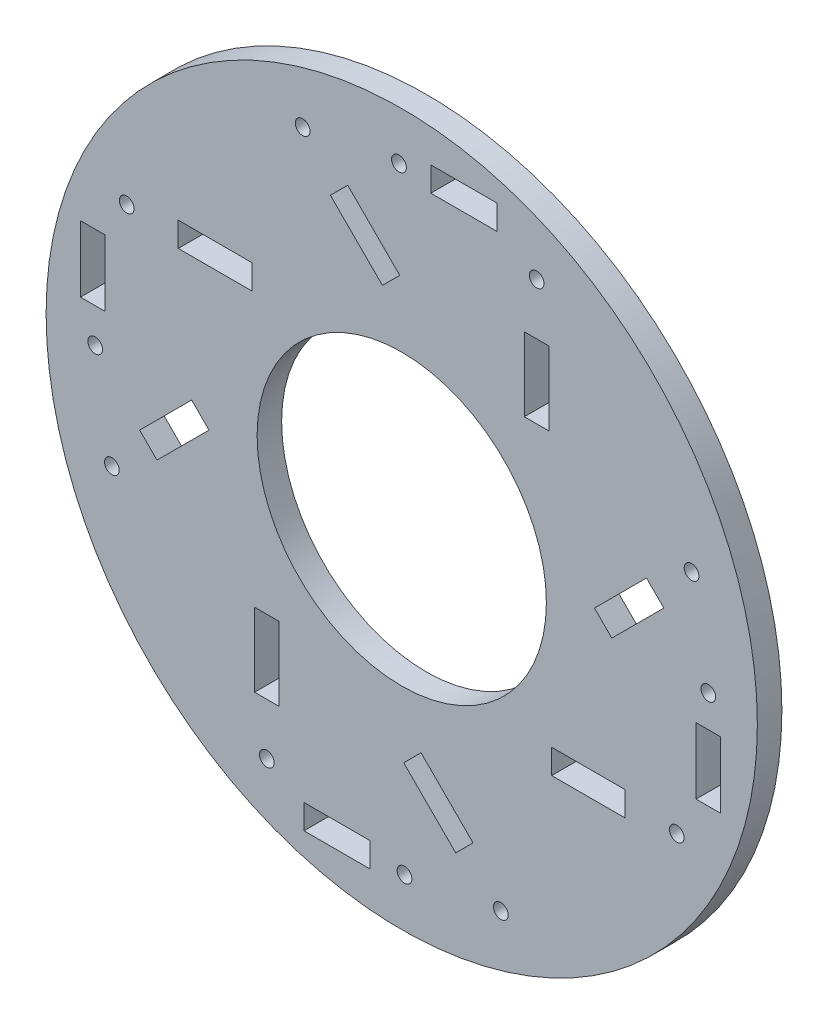
from build123d import *

# Parameters (mm, degrees)
SKETCH1_R           = 72.5
SKETCH1_R_2         = 1.5
SKETCH1_W           = 13.5
SKETCH1_H           = 5
SKETCH1_W_2         = 5
SKETCH1_H_2         = 15
SKETCH1_W_3         = 15
SKETCH1_H_3         = 13.5
BOSS_EXTRUDE1_DEPTH = 5
SKETCH2_R           = 29.487342093
CUT_EXTRUDE1_DEPTH  = 10


with BuildPart() as part:
    # Sketch1 → Boss-Extrude1 (new body)
    with BuildSketch(Plane.XY):
        Circle(SKETCH1_R)
        with Locations((-27.5, -56.065506466)):
            Circle(SKETCH1_R_2, mode=Mode.SUBTRACT)
        with Locations((-13.184493534, -62.5)):
            Rectangle(SKETCH1_W, SKETCH1_H, mode=Mode.SUBTRACT)
        with Locations((-27.5, -38.065506466)):
            Rectangle(SKETCH1_W_2, SKETCH1_H_2, mode=Mode.SUBTRACT)
        with Locations((-59.089736296, -20.19886333)):
            Circle(SKETCH1_R_2, mode=Mode.SUBTRACT)
        with Locations((-62.5, -0.565506466)):
            Circle(SKETCH1_R_2, mode=Mode.SUBTRACT)
        Polygon((-42.826280328, -0.399873457), (-39.290746422, -3.935407363), (-49.89734814, -14.542009081), (-53.432882046, -11.006475175), align=None, mode=Mode.SUBTRACT)
        with Locations((0.565506466, -62.5)):
            Circle(SKETCH1_R_2, mode=Mode.SUBTRACT)
        with Locations((20.19886333, -59.089736296)):
            Circle(SKETCH1_R_2, mode=Mode.SUBTRACT)
        Polygon((0.399873457, -42.826280328), (3.935407363, -39.290746422), (14.542009081, -49.89734814), (11.006475175, -53.432882046), align=None, mode=Mode.SUBTRACT)
        with Locations((38.065506466, -27.5)):
            Rectangle(SKETCH1_W_3, SKETCH1_H, mode=Mode.SUBTRACT)
        with Locations((56.065506466, -27.5)):
            Circle(SKETCH1_R_2, mode=Mode.SUBTRACT)
        with Locations((62.5, -12.684493534)):
            Rectangle(SKETCH1_W_2, SKETCH1_H_3, mode=Mode.SUBTRACT)
        with Locations((-63, 13.184493534)):
            Rectangle(SKETCH1_W_2, SKETCH1_H_3, mode=Mode.SUBTRACT)
        with Locations((-56.065506466, 27.5)):
            Circle(SKETCH1_R_2, mode=Mode.SUBTRACT)
        with Locations((-38.065506466, 27.5)):
            Rectangle(SKETCH1_W_3, SKETCH1_H, mode=Mode.SUBTRACT)
        Polygon((-0.399873457, 42.826280328), (-3.935407363, 39.290746422), (-14.542009081, 49.89734814), (-11.006475175, 53.432882046), align=None, mode=Mode.SUBTRACT)
        with Locations((-20.19886333, 59.089736296)):
            Circle(SKETCH1_R_2, mode=Mode.SUBTRACT)
        with Locations((-0.565506466, 62.5)):
            Circle(SKETCH1_R_2, mode=Mode.SUBTRACT)
        Polygon((42.826280328, 0.399873457), (39.290746422, 3.935407363), (49.89734814, 14.542009081), (53.432882046, 11.006475175), align=None, mode=Mode.SUBTRACT)
        with Locations((62.5, 0.565506466)):
            Circle(SKETCH1_R_2, mode=Mode.SUBTRACT)
        with Locations((59.089736296, 20.19886333)):
            Circle(SKETCH1_R_2, mode=Mode.SUBTRACT)
        with Locations((27.5, 38.065506466)):
            Rectangle(SKETCH1_W_2, SKETCH1_H_2, mode=Mode.SUBTRACT)
        with Locations((12.684493534, 63)):
            Rectangle(SKETCH1_W, SKETCH1_H, mode=Mode.SUBTRACT)
        with Locations((27.5, 56.065506466)):
            Circle(SKETCH1_R_2, mode=Mode.SUBTRACT)
    extrude(amount=BOSS_EXTRUDE1_DEPTH)

    # Sketch2 → Cut-Extrude1 (cut)
    with BuildSketch(Plane.XY.offset(5)):
        Circle(SKETCH2_R)
    extrude(amount=-CUT_EXTRUDE1_DEPTH, mode=Mode.SUBTRACT)


solid = part.part
